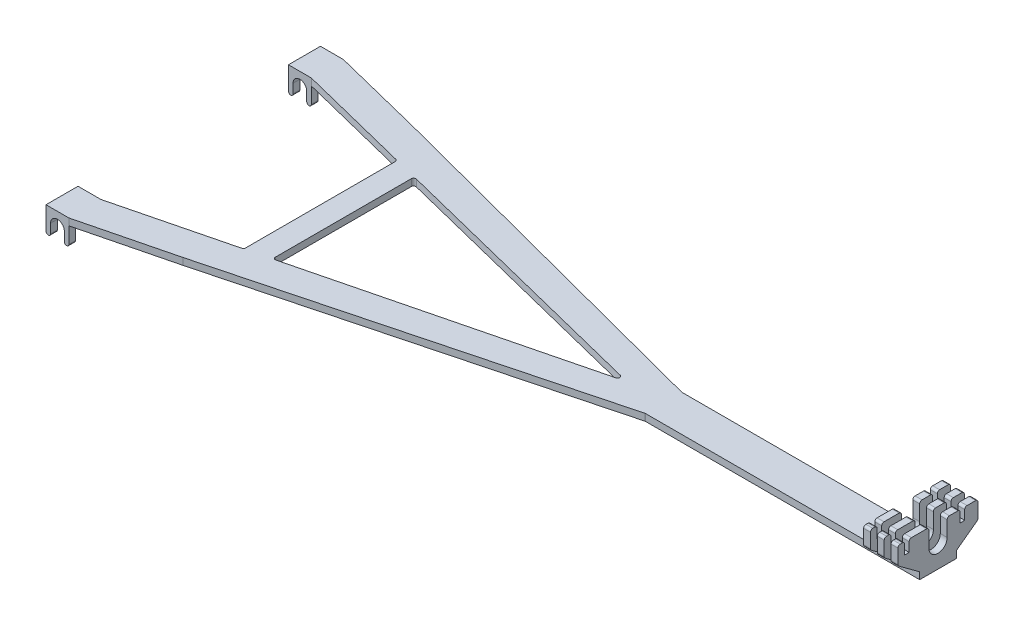
from build123d import *

# Parameters (mm, degrees)
BOSS_EXTRUDE1_DEPTH             = 15
BOSS_EXTRUDE2_REACH             = 1239.023
BOSS_EXTRUDE2_DIRECTION_2_REACH = 1239.023
CUT_EXTRUDE2_DEPTH              = 1238.578280352
CUT_EXTRUDE2_DEPTH_BACK         = 1238.578280352
SKETCH5_W                       = 40
SKETCH5_H                       = 40
CUT_EXTRUDE3_DEPTH              = 1238.578280352
BOSS_EXTRUDE4_DEPTH             = 75
CUT_EXTRUDE4_DEPTH              = 1241.107934819
CUT_EXTRUDE4_DEPTH_BACK         = 1241.107934819
SKETCH8_W                       = 15
SKETCH8_H                       = 73.7
FILLET1_R                       = 5


with BuildPart() as part:
    # Sketch1 → Boss-Extrude1 (new body)
    with BuildSketch(Plane(origin=(0, 0, 0), x_dir=(1, 0, 0), z_dir=(0, 1, 0))):
        Polygon((-450, 300), (-400, 300), (-200, 250), (600, 40), (1200, 40), (1200, -40), (600, -40), (-200, -250), (-400, -300), (-450, -300), align=None)
    extrude(amount=BOSS_EXTRUDE1_DEPTH)

    # Boss-Extrude2: up to this face of the body (flat: up to its plane)
    boss_extrude2_end = Plane(part.part.faces().sort_by_distance((-425, 7.5, 300))[0])
    # Sketch2 → Boss-Extrude2 (add, up to the picked face)
    with BuildSketch(Plane.XY, mode=Mode.PRIVATE) as boss_extrude2_sk1:
        with BuildLine():
            Line((-425, 0), (-450, 0))
            Line((-450, 0), (-450, -40))
            Line((-450, -40), (-440, -40))
            Line((-440, -40), (-440, -15))
            ThreePointArc((-440, -15), (-435.606601718, -4.393398282), (-425, 0))
        make_face()
    boss_extrude2_tool1 = split(extrude(boss_extrude2_sk1.sketch, amount=BOSS_EXTRUDE2_REACH, mode=Mode.PRIVATE), bisect_by=boss_extrude2_end, keep=Keep.BOTH, mode=Mode.PRIVATE)
    # Sketch2 → Boss-Extrude2 (add, up to the picked face)
    with BuildSketch(Plane.XY, mode=Mode.PRIVATE) as boss_extrude2_sk2:
        with BuildLine():
            Line((-400, 0), (-425, 0))
            ThreePointArc((-425, 0), (-414.393398282, -4.393398282), (-410, -15))
            Line((-410, -15), (-410, -40))
            Line((-410, -40), (-400, -40))
            Line((-400, -40), (-400, 0))
        make_face()
    boss_extrude2_tool2 = split(extrude(boss_extrude2_sk2.sketch, amount=BOSS_EXTRUDE2_REACH, mode=Mode.PRIVATE), bisect_by=boss_extrude2_end, keep=Keep.BOTH, mode=Mode.PRIVATE)
    add(boss_extrude2_tool1.solids().sort_by(Axis((-444.100555, -18.206662, 0), (0, 0, 1)))[0])
    add(boss_extrude2_tool2.solids().sort_by(Axis((-405.899445, -18.206662, 0), (0, 0, 1)))[0])

    # Boss-Extrude2 direction 2: up to this face of the body (flat: up to its plane)
    boss_extrude2_direction_2_end = Plane(part.part.faces().sort_by_distance((-425, 7.5, -300))[0])
    # Sketch2 → Boss-Extrude2 direction 2 (add, up to the picked face)
    with BuildSketch(Plane.XY, mode=Mode.PRIVATE) as boss_extrude2_direction_2_sk1:
        with BuildLine():
            Line((-425, 0), (-450, 0))
            Line((-450, 0), (-450, -40))
            Line((-450, -40), (-440, -40))
            Line((-440, -40), (-440, -15))
            ThreePointArc((-440, -15), (-435.606601718, -4.393398282), (-425, 0))
        make_face()
    boss_extrude2_direction_2_tool1 = split(extrude(boss_extrude2_direction_2_sk1.sketch, amount=-BOSS_EXTRUDE2_DIRECTION_2_REACH, mode=Mode.PRIVATE), bisect_by=boss_extrude2_direction_2_end, keep=Keep.BOTH, mode=Mode.PRIVATE)
    # Sketch2 → Boss-Extrude2 direction 2 (add, up to the picked face)
    with BuildSketch(Plane.XY, mode=Mode.PRIVATE) as boss_extrude2_direction_2_sk2:
        with BuildLine():
            Line((-400, 0), (-425, 0))
            ThreePointArc((-425, 0), (-414.393398282, -4.393398282), (-410, -15))
            Line((-410, -15), (-410, -40))
            Line((-410, -40), (-400, -40))
            Line((-400, -40), (-400, 0))
        make_face()
    boss_extrude2_direction_2_tool2 = split(extrude(boss_extrude2_direction_2_sk2.sketch, amount=-BOSS_EXTRUDE2_DIRECTION_2_REACH, mode=Mode.PRIVATE), bisect_by=boss_extrude2_direction_2_end, keep=Keep.BOTH, mode=Mode.PRIVATE)
    add(boss_extrude2_direction_2_tool1.solids().sort_by(Axis((-444.100555, -18.206662, 0), (0, 0, -1)))[0])
    add(boss_extrude2_direction_2_tool2.solids().sort_by(Axis((-405.899445, -18.206662, 0), (0, 0, -1)))[0])

    # Sketch4 → Cut-Extrude2 (cut, two sides: drawn at the far end of the back side and taken through both)
    with BuildSketch(Plane(origin=(0, 0, 0), x_dir=(1, 0, 0), z_dir=(0, 1, 0)).offset(-CUT_EXTRUDE2_DEPTH_BACK)):
        Polygon((-450, 230), (-400, 230), (-150, 167.5), (-150, -167.5), (-400, -230), (-450, -230), align=None)
        Polygon((-100, 155), (-100, -155), (520, 0), align=None)
    extrude(amount=CUT_EXTRUDE2_DEPTH + CUT_EXTRUDE2_DEPTH_BACK, mode=Mode.SUBTRACT)

    # Sketch5 → Cut-Extrude3 (cut, through all)
    with BuildSketch(Plane(origin=(0, 0, 0), x_dir=(0, 0, -1), z_dir=(1, 0, 0))):
        with Locations((-265, -20)):
            Rectangle(SKETCH5_W, SKETCH5_H)
        with Locations((265, -20)):
            Rectangle(SKETCH5_W, SKETCH5_H)
    extrude(amount=-CUT_EXTRUDE3_DEPTH, mode=Mode.SUBTRACT)

    # Sketch7 → Boss-Extrude4 (add)
    with BuildSketch(Plane(origin=(1200, 0, 0), x_dir=(0, 0, -1), z_dir=(1, 0, 0))):
        with BuildLine():
            Line((-87.5, 50), (-40, 15))
            Line((-40, 15), (40, 15))
            Line((40, 15), (87.5, 50))
            Line((87.5, 50), (87.5, 88.7))
            Line((87.5, 88.7), (58.5, 88.7))
            Line((58.5, 88.7), (58.5, 63.2))
            Line((58.5, 63.2), (48.5, 63.2))
            Line((48.5, 63.2), (48.5, 88.7))
            Line((48.5, 88.7), (20, 88.7))
            Line((20, 88.7), (20, 50))
            ThreePointArc((20, 50), (0, 30), (-20, 50))
            Line((-20, 50), (-20, 88.7))
            Line((-20, 88.7), (-63, 88.7))
            Line((-63, 88.7), (-63, 63.2))
            Line((-63, 63.2), (-73, 63.2))
            Line((-73, 63.2), (-73, 88.7))
            Line((-73, 88.7), (-87.5, 88.7))
            Line((-87.5, 88.7), (-87.5, 50))
        make_face()
    extrude(amount=-BOSS_EXTRUDE4_DEPTH)

    # Sketch8 → Cut-Extrude4 (cut, two sides: drawn at the far end of the back side and taken through both)
    with BuildSketch(Plane.XY.offset(-CUT_EXTRUDE4_DEPTH_BACK)):
        with Locations((1147.5, 51.85)):
            Rectangle(SKETCH8_W, SKETCH8_H)
        with Locations((1177.5, 51.85)):
            Rectangle(SKETCH8_W, SKETCH8_H)
    extrude(amount=CUT_EXTRUDE4_DEPTH + CUT_EXTRUDE4_DEPTH_BACK, mode=Mode.SUBTRACT)

    # Fillet1
    fillet1_edges = [part.edges().sort_by_distance(p)[0] for p in [
        (1192.5, 50, 87.5),
        (1162.5, 50, 87.5),
        (1132.5, 50, 87.5),
        (1192.5, 50, -87.5),
        (1162.5, 50, -87.5),
        (1132.5, 50, -87.5),
        (1192.5, 88.7, -87.5),
        (1162.5, 88.7, -87.5),
        (1132.5, 88.7, -87.5),
        (1132.5, 88.7, -58.5),
        (1162.5, 88.7, -58.5),
        (1192.5, 88.7, -58.5),
        (1192.5, 88.7, -48.5),
        (1162.5, 88.7, -48.5),
        (1132.5, 88.7, -48.5),
        (1192.5, 88.7, -20),
        (1162.5, 88.7, -20),
        (1132.5, 88.7, -20),
        (1192.5, 88.7, 63),
        (1162.5, 88.7, 63),
        (1132.5, 88.7, 63),
        (1132.5, 88.7, 87.5),
        (1162.5, 88.7, 87.5),
        (1192.5, 88.7, 87.5),
        (1192.5, 88.7, 73),
        (1162.5, 88.7, 73),
        (1132.5, 88.7, 73),
        (1192.5, 88.7, 20),
        (1162.5, 88.7, 20),
        (1132.5, 88.7, 20),
        (600, 7.5, 40),
        (600, 7.5, -40),
        (520, 7.5, 0),
        (-440, -40, -292.5),
        (-440, -40, -237.5),
        (-400, -40, -292.5),
        (-400, -40, -237.5),
        (-450, -40, -237.5),
        (-410, -40, -237.5),
        (-450, -40, -292.5),
        (-410, -40, -292.5),
        (-150, 7.5, 167.5),
        (-100, 7.5, 155),
        (-150, 7.5, -167.5),
        (-100, 7.5, -155),
        (-450, -40, 237.5),
        (-410, -40, 237.5),
        (-440, -40, 237.5),
        (-400, -40, 237.5),
        (-450, -40, 292.5),
        (-440, -40, 292.5),
        (-400, -40, 292.5),
        (-410, -40, 292.5),
    ]]
    fillet(fillet1_edges, radius=FILLET1_R - 0.0001)  # a hair under: the kernel refuses the full size


solid = part.part
